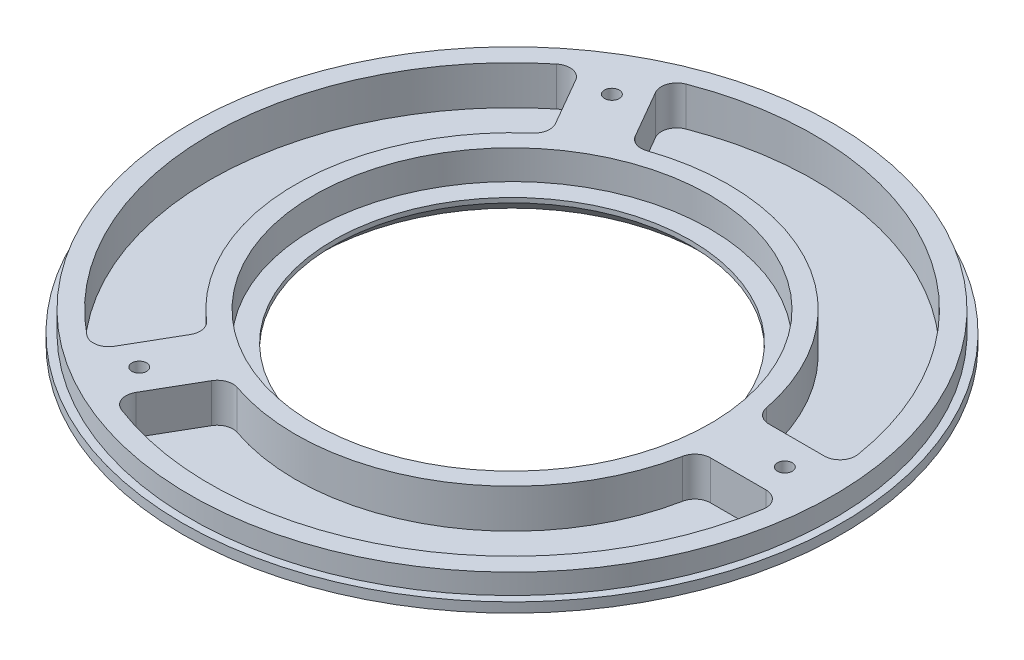
from build123d import *

# Parameters (mm, degrees)
F_90_0_0087_DIAMETER_HOLE1_D                        = 0.22098
CIRPATTERN3_COUNT                                   = 3
CUT_EXTRUDE1_DEPTH                                  = 10
FILLET1_R                                           = 4
CIRPATTERN4_COUNT                                   = 3
FILLET1_OF_CIRPATTERN4_R                            = 4
CHAMFER1_SIZE                                       = 4
BOSS_EXTRUDE1_START                                 = -7.5
SKETCH10_R                                          = 84.55
SKETCH10_R_2                                        = 82.55
BOSS_EXTRUDE1_DEPTH                                 = 7.5
CHAMFER3_SIZE                                       = 5
CHAMFER3_SIZE2                                      = 8.660254038
FILLET4_R                                           = 5
CBORE_FOR_6_BINDING_HEAD_MACHINE_SCREW1_D           = 3.7973
CBORE_FOR_6_BINDING_HEAD_MACHINE_SCREW1_CBORE_D     = 7.9375
CBORE_FOR_6_BINDING_HEAD_MACHINE_SCREW1_CBORE_DEPTH = 2.2098
CIRPATTERN5_COUNT                                   = 3


with BuildPart() as part:
    # Sketch2 → Revolve1 (revolve)
    with BuildSketch(Plane(origin=(0, 0, 0), x_dir=(0, 0, -1), z_dir=(1, 0, 0))):
        Polygon((-45.8, 0), (-82.55, 0), (-82.55, 12.7), (-50.8, 12.7), (-50.8, 5.2), (-45.8, 5.2), align=None)
    revolve(axis=Axis((0, -0.635, 0), (0, 1, 0)))

    # #90 (0.0087) Diameter Hole1 (through all)
    with Locations(Plane(origin=(0, 12.7, 0), x_dir=(1, 0, 0), z_dir=(0, 1, 0))):
        with Locations((-35, 60.621778265)):
            f_90_0_0087_diameter_hole1 = Hole(F_90_0_0087_DIAMETER_HOLE1_D / 2)

    # CirPattern3: #90 (0.0087) Diameter Hole1 ×3 about axis
    cirpattern3_axis = Axis((0, -0.635, 0), (0, 1, 0))
    for i in range(1, CIRPATTERN3_COUNT):
        add(f_90_0_0087_diameter_hole1.rotate(cirpattern3_axis, i * 360 / CIRPATTERN3_COUNT), mode=Mode.SUBTRACT)

    # Sketch8 → Cut-Extrude1 (cut)
    with BuildSketch(Plane(origin=(0, 12.7, 0), x_dir=(1, 0, 0), z_dir=(0, 1, 0))):
        with BuildLine():
            Line((-21.025494874, 51.417225376), (-32.098048841, 70.595451416))
            ThreePointArc((-32.098048841, 70.595451416), (38.775, 67.160270063), (77.186478738, 7.5))
            Line((77.186478738, 7.5), (55.041370804, 7.5))
            ThreePointArc((55.041370804, 7.5), (27.775, 48.10771118), (-21.025494874, 51.417225376))
        make_face()
    cut_extrude1 = extrude(amount=-CUT_EXTRUDE1_DEPTH, mode=Mode.SUBTRACT)

    # Fillet1
    fillet1_edges = [part.edges().sort_by_distance(p)[0] for p in [
        (-21.025494874, 7.7, -51.417225376),
        (55.041370804, 7.7, -7.5),
        (77.186478738, 7.7, -7.5),
        (-32.098048841, 7.7, -70.595451416),
    ]]
    fillet(fillet1_edges, radius=FILLET1_R)

    # CirPattern4: Cut-Extrude1 ×3 about axis
    cirpattern4_axis = Axis((0, -0.635, 0), (0, 1, 0))
    for i in range(1, CIRPATTERN4_COUNT):
        add(cut_extrude1.rotate(cirpattern4_axis, i * 360 / CIRPATTERN4_COUNT), mode=Mode.SUBTRACT)

    # Fillet1 of CirPattern4
    fillet1_of_cirpattern4_edges = [part.edges().sort_by_distance(p)[0] for p in [
        (-34.01587593, 7.7, 43.917225376),
        (-34.01587593, 7.7, -43.917225376),
        (-45.088429897, 7.7, -63.095451416),
        (-45.088429897, 7.7, 63.095451416),
        (55.041370804, 7.7, 7.5),
        (-21.025494874, 7.7, 51.417225376),
        (-32.098048841, 7.7, 70.595451416),
        (77.186478738, 7.7, 7.5),
    ]]
    fillet(fillet1_of_cirpattern4_edges, radius=FILLET1_OF_CIRPATTERN4_R)

    # Chamfer1
    chamfer1_edges = [part.edges().sort_by_distance(p)[0] for p in [
        (0, 0, -45.8),
    ]]
    chamfer(chamfer1_edges, length=CHAMFER1_SIZE)

    # Sketch10 → Boss-Extrude1 (add)
    with BuildSketch(Plane.XZ.offset(BOSS_EXTRUDE1_START)):
        Circle(SKETCH10_R)
        Circle(SKETCH10_R_2, mode=Mode.SUBTRACT)
    extrude(amount=BOSS_EXTRUDE1_DEPTH)

    # Chamfer3
    chamfer3_edges = [part.edges().sort_by_distance(p)[0] for p in [
        (-84.55, 0, 0),
    ]]
    chamfer3_side = [part.faces().sort_by_distance(p)[0] for p in [
        (-84.55, 3.75, 0),
    ]]
    chamfer(chamfer3_edges, length=CHAMFER3_SIZE, length2=CHAMFER3_SIZE2, reference=chamfer3_side[0])

    # Fillet4
    fillet4_edges = [part.edges().sort_by_distance(p)[0] for p in [
        (-75.889745962, 0, 0),
    ]]
    fillet(fillet4_edges, radius=FILLET4_R)

    # CBORE for #6 Binding Head Machine Screw1 (through all)
    with Locations(Plane(origin=(0, 0, 0), x_dir=(-1, 0, 0), z_dir=(0, -1, 0))):
        with Locations((35, 60.621778265)):
            cbore_for_6_binding_head_machine_screw1 = CounterBoreHole(CBORE_FOR_6_BINDING_HEAD_MACHINE_SCREW1_D / 2, CBORE_FOR_6_BINDING_HEAD_MACHINE_SCREW1_CBORE_D / 2, CBORE_FOR_6_BINDING_HEAD_MACHINE_SCREW1_CBORE_DEPTH)

    # CirPattern5: CBORE for #6 Binding Head Machine Screw1 ×3 about axis
    cirpattern5_axis = Axis((0, -0.635, 0), (0, 1, 0))
    for i in range(1, CIRPATTERN5_COUNT):
        add(cbore_for_6_binding_head_machine_screw1.rotate(cirpattern5_axis, i * 360 / CIRPATTERN5_COUNT), mode=Mode.SUBTRACT)


solid = part.part
